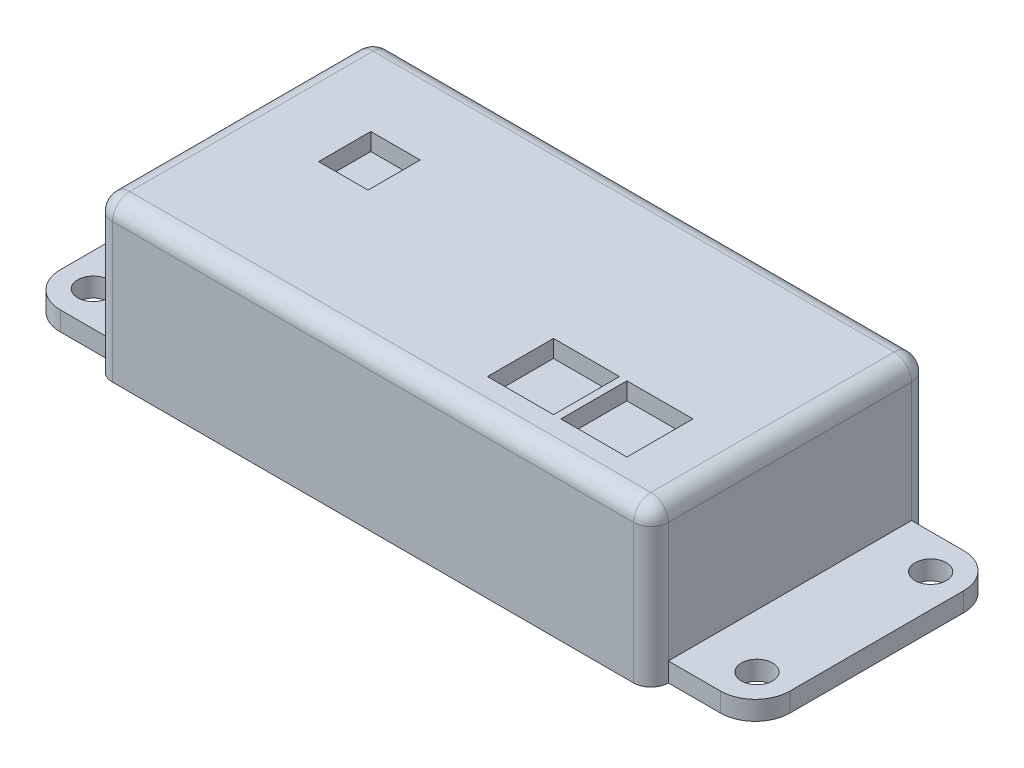
from build123d import *

# Parameters (mm, degrees)
SKETCH1_W            = 81.28
SKETCH1_H            = 40.64
BOSS_EXTRUDE1_DEPTH  = 22.86
FILLET1_R            = 2.54
SKETCH2_W            = 12.7
SKETCH2_H            = 35.56
BOSS_EXTRUDE2_DEPTH  = 2.794
FILLET2_R            = 5.08
SKETCH3_R            = 2.286
CUT_EXTRUDE1_DEPTH   = 61.503738364
FILLET2_OF_MIRROR1_R = 5.08
SKETCH4_W            = 7.230266788
SKETCH4_H            = 7.631948276
SKETCH4_W_2          = 9.652
SKETCH4_H_2          = 9.652
CUT_EXTRUDE2_DEPTH   = 2.54


with BuildPart() as part:
    # Sketch1 → Boss-Extrude1 (new body)
    with BuildSketch(Plane(origin=(0, 0, 0), x_dir=(1, 0, 0), z_dir=(0, 1, 0))):
        Rectangle(SKETCH1_W, SKETCH1_H)
    extrude(amount=BOSS_EXTRUDE1_DEPTH)

    # Fillet1
    fillet1_edges = [part.edges().sort_by_distance(p)[0] for p in [
        (-40.64, 11.43, -20.32),
        (40.64, 11.43, -20.32),
        (0, 22.86, -20.32),
        (-40.64, 22.86, 0),
        (-40.64, 11.43, 20.32),
        (40.64, 11.43, 20.32),
        (40.64, 22.86, 0),
        (0, 22.86, 20.32),
    ]]
    fillet(fillet1_edges, radius=FILLET1_R)

    # Sketch2 → Boss-Extrude2 (add)
    with BuildSketch(Plane.XZ):
        with Locations((46.99, 0)):
            Rectangle(SKETCH2_W, SKETCH2_H)
    boss_extrude2 = extrude(amount=-BOSS_EXTRUDE2_DEPTH)

    # Fillet2
    fillet2_edges = [part.edges().sort_by_distance(p)[0] for p in [
        (53.34, 1.397, -17.78),
        (53.34, 1.397, 17.78),
    ]]
    fillet(fillet2_edges, radius=FILLET2_R)

    # Sketch3 → Cut-Extrude1 (cut, through all)
    with BuildSketch(Plane(origin=(0, 2.794, 0), x_dir=(1, 0, 0), z_dir=(0, 1, 0))):
        with Locations((48.514, 12.7)):
            Circle(SKETCH3_R)
        with Locations((48.514, -12.7)):
            Circle(SKETCH3_R)
    cut_extrude1 = extrude(amount=-CUT_EXTRUDE1_DEPTH, mode=Mode.SUBTRACT)

    # Mirror1: Boss-Extrude2, Cut-Extrude1 across plane
    add(boss_extrude2.mirror(Plane(origin=(0, 0, 0), x_dir=(0, 0, 1), z_dir=(1, 0, 0))))
    add(cut_extrude1.mirror(Plane(origin=(0, 0, 0), x_dir=(0, 0, 1), z_dir=(1, 0, 0))), mode=Mode.SUBTRACT)

    # Fillet2 of Mirror1
    fillet2_of_mirror1_edges = [part.edges().sort_by_distance(p)[0] for p in [
        (-53.34, 1.397, -17.78),
        (-53.34, 1.397, 17.78),
    ]]
    fillet(fillet2_of_mirror1_edges, radius=FILLET2_OF_MIRROR1_R)

    # Sketch4 → Cut-Extrude2 (cut)
    with BuildSketch(Plane(origin=(0, 22.86, 0), x_dir=(1, 0, 0), z_dir=(0, 1, 0))):
        with Locations((-24.473297313, 3.624026455)):
            Rectangle(SKETCH4_W, SKETCH4_H)
        with Locations((16.303343502, -10.232970532)):
            Rectangle(SKETCH4_W_2, SKETCH4_H_2)
        with Locations((27.032885284, -10.232970532)):
            Rectangle(SKETCH4_W_2, SKETCH4_H_2)
    extrude(amount=-CUT_EXTRUDE2_DEPTH, mode=Mode.SUBTRACT)


solid = part.part
